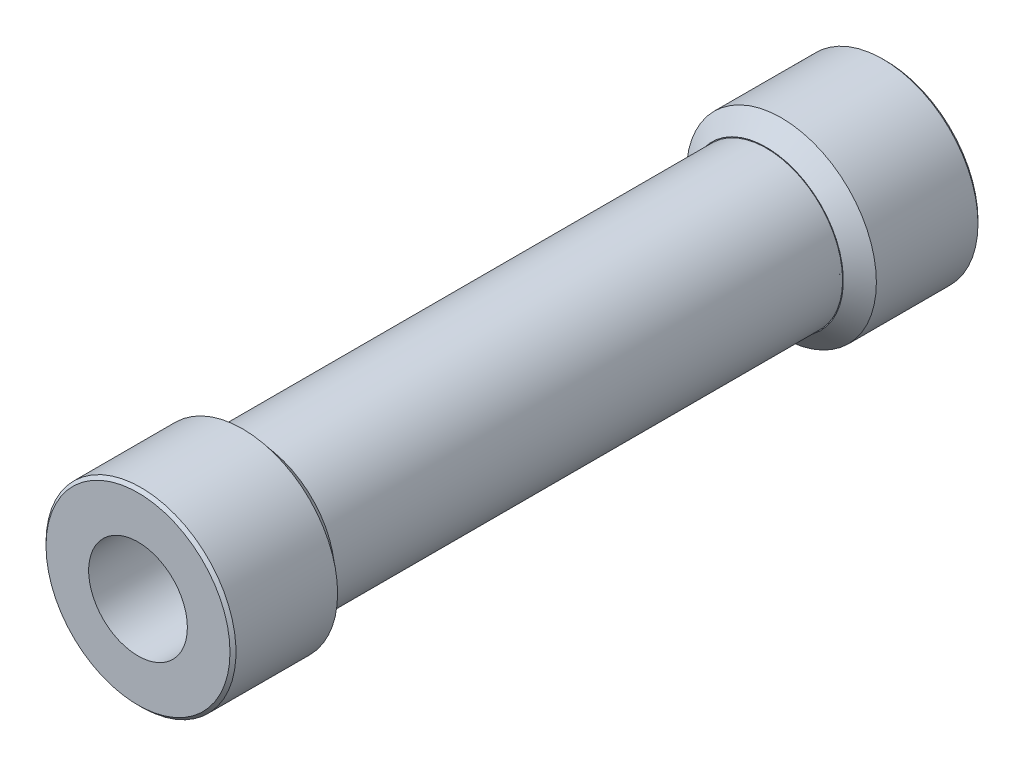
from build123d import *

# Parameters (mm, degrees)
IZIM1_W                     = 17
IZIM1_H                     = 2.55
IZIM4_R                     = 2.575
Y_KSEKLIK_EKSTR_ZYON1_DEPTH = 0.6
IZIM5_R                     = 3.175
Y_KSEKLIK_EKSTR_ZYON2_DEPTH = 3.4
IZIM7_R                     = 2.575
Y_KSEKLIK_EKSTR_ZYON4_DEPTH = 0.6
Y_KSEKLIK_EKSTR_ZYON5_START = 3.4
IZIM8_R                     = 3.175
Y_KSEKLIK_EKSTR_ZYON5_DEPTH = 3.4
IZIM9_R                     = 1.65
KES_EKSTR_ZYON1_DEPTH       = 100
PAH1_SIZE                   = 0.1


# Read off the part's stored shape, not the designer's step: Draft2, Draft3
with BuildPart() as part:
    # Çizim1 → Döndür3 (revolve)
    with BuildSketch(Plane(origin=(0, 0, 0), x_dir=(0, 0, -1), z_dir=(1, 0, 0)), mode=Mode.PRIVATE) as d_nd_r3_sk:
        with Locations((0, -1.275)):
            Rectangle(IZIM1_W, IZIM1_H)
    revolve(d_nd_r3_sk.sketch.rotate(Axis((0, 0, 15.544933078), (0, 0, -1)), 270), axis=Axis((0, 0, 15.544933078), (0, 0, -1)))

    # Çizim4 → Yükseklik-Ekstrüzyon1 (add)
    with BuildSketch(Plane(origin=(0, 0, -8.5), x_dir=(-1, 0, 0), z_dir=(0, 0, -1))):
        Circle(IZIM4_R)
    extrude(amount=Y_KSEKLIK_EKSTR_ZYON1_DEPTH)

    # Çizim5 → Yükseklik-Ekstrüzyon2 (add)
    with BuildSketch(Plane(origin=(0, 0, -9.1), x_dir=(-1, 0, 0), z_dir=(0, 0, -1))):
        Circle(IZIM5_R)
    extrude(amount=Y_KSEKLIK_EKSTR_ZYON2_DEPTH)

    # Draft2 outline → Draft2 (revolve)
    with BuildSketch(Plane.XZ):
        Polygon((3.175, -9.003459779), (2.575, -8.5), (2.575, -9.1), (3.175, -9.1), align=None)
    revolve(axis=Axis((0, 0, 0), (0, 0, 1)))

    # Çizim7 → Yükseklik-Ekstrüzyon4 (add)
    with BuildSketch(Plane.XY.offset(8.5)):
        Circle(IZIM7_R)
    extrude(amount=Y_KSEKLIK_EKSTR_ZYON4_DEPTH)

    # Çizim8 → Yükseklik-Ekstrüzyon5 (add)
    with BuildSketch(Plane.XY.offset(9.1).offset(Y_KSEKLIK_EKSTR_ZYON5_START)):
        with Locations(Location((0, 0, 0), (0, 0, 180))):
            Circle(IZIM8_R)
    extrude(amount=-Y_KSEKLIK_EKSTR_ZYON5_DEPTH)

    # Draft3 outline → Draft3 (revolve)
    with BuildSketch(Plane.XZ):
        Polygon((2.575, 8.5), (3.175, 9.003459779), (3.175, 9.1), (2.575, 9.1), align=None)
    revolve(axis=Axis((0, 0, 0), (0, 0, 1)))

    # Çizim9 → Kes-Ekstrüzyon1 (cut)
    with BuildSketch(Plane.XY.offset(12.5)):
        Circle(IZIM9_R)
    extrude(amount=-KES_EKSTR_ZYON1_DEPTH, mode=Mode.SUBTRACT)

    # Pah1
    pah1_edges = [part.edges().sort_by_distance(p)[0] for p in [
        (3.175, 0, -12.5),
        (3.175, 0, 12.5),
    ]]
    chamfer(pah1_edges, length=PAH1_SIZE)


solid = part.part
